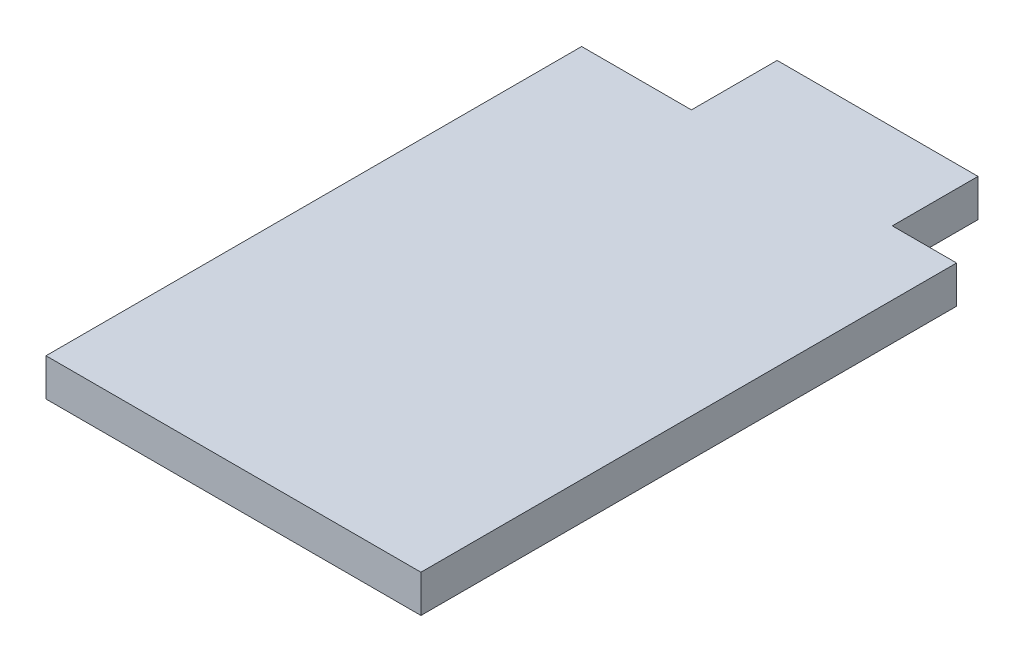
from build123d import *

# Parameters (mm, degrees)
SKETCH1_W           = 70
SKETCH1_H           = 100
BOSS_EXTRUDE1_DEPTH = 7
SKETCH2_R           = 1.5
CUT_EXTRUDE1_DEPTH  = 5
SKETCH3_W           = 37.5
SKETCH3_H           = 16
BOSS_EXTRUDE2_DEPTH = 7


with BuildPart() as part:
    # Sketch1 → Boss-Extrude1 (new body)
    with BuildSketch(Plane(origin=(0, 0, 0), x_dir=(1, 0, 0), z_dir=(0, 1, 0))):
        Rectangle(SKETCH1_W, SKETCH1_H)
    extrude(amount=BOSS_EXTRUDE1_DEPTH)

    # Sketch2 → Cut-Extrude1 (cut)
    with BuildSketch(Plane.XZ):
        with Locations((-30.5, -36.5)):
            Circle(SKETCH2_R)
        with Locations((-30.5, 39.5)):
            Circle(SKETCH2_R)
        with Locations((30.5, 39.5)):
            Circle(SKETCH2_R)
        with Locations((30.5, -36.5)):
            Circle(SKETCH2_R)
    extrude(amount=-CUT_EXTRUDE1_DEPTH, mode=Mode.SUBTRACT)

    # Sketch3 → Boss-Extrude2 (add)
    with BuildSketch(Plane.XZ):
        with Locations((4.25, -58)):
            Rectangle(SKETCH3_W, SKETCH3_H)
    extrude(amount=-BOSS_EXTRUDE2_DEPTH)


solid = part.part
